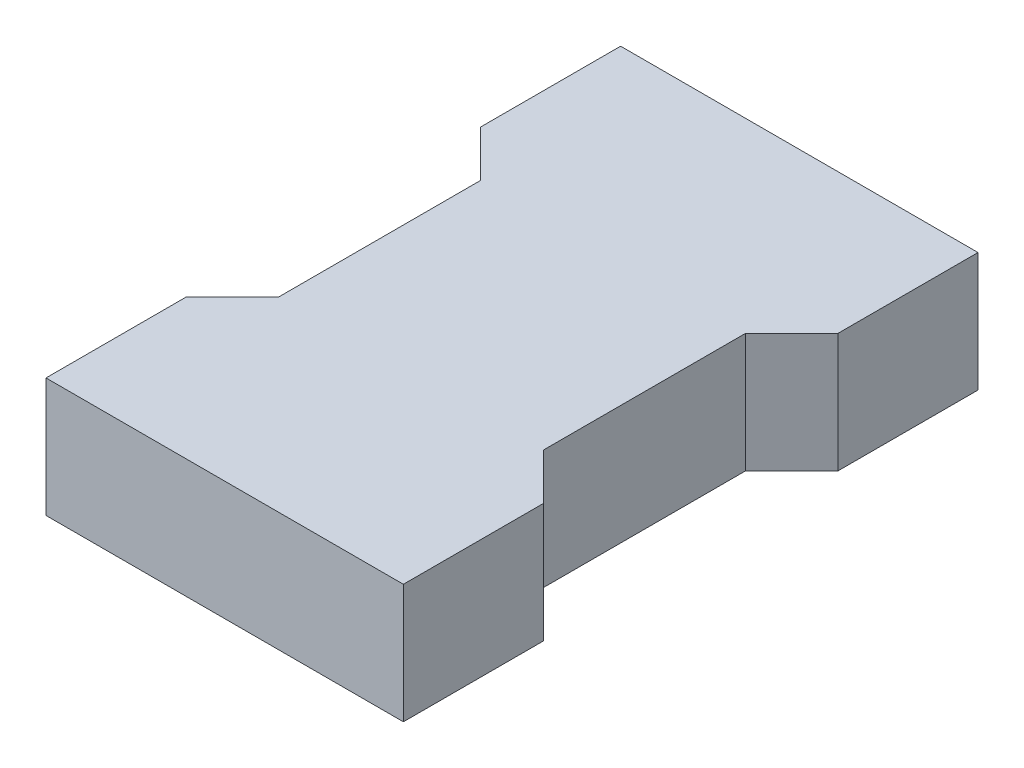
from build123d import *

# Parameters (mm, degrees)
EXTRUDE_1_DEPTH = 17


with BuildPart() as part:
    # 草图1 → 凸台-拉伸1 (new body)
    with BuildSketch(Plane(origin=(0, 0, 0), x_dir=(1, 0, 0), z_dir=(0, 1, 0))):
        Polygon((-25.5, 21), (-18.902616279, 14.402616279), (-18.902616279, -14.402616279), (-25.5, -21), (-25.5, -41), (25.5, -41), (25.5, -21), (18.902616279, -14.402616279), (18.902616279, 14.402616279), (25.5, 21), (25.5, 41), (-25.5, 41), align=None)
    extrude(amount=EXTRUDE_1_DEPTH)


solid = part.part
